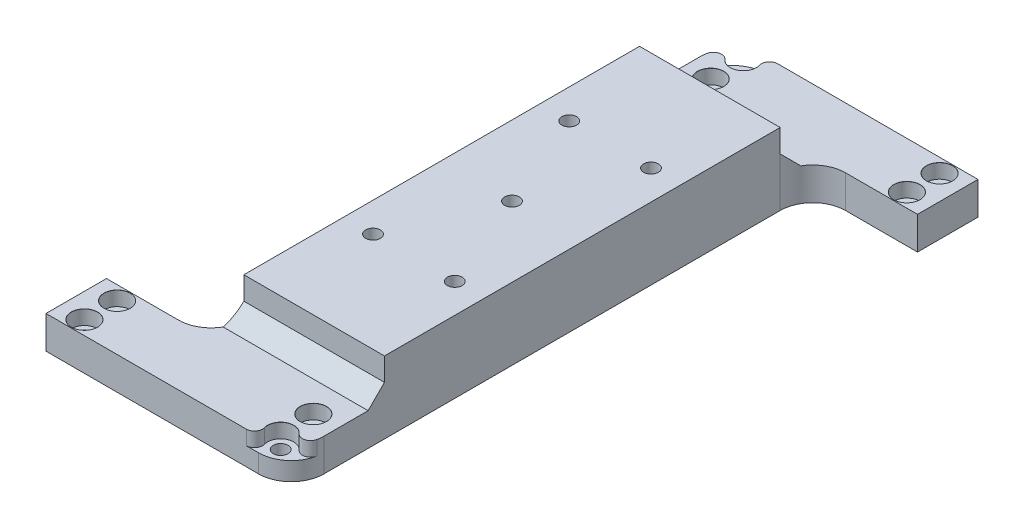
from build123d import *

# Parameters (mm, degrees)
BOSS_EXTRUDE1_DEPTH                          = 10
FILLET1_R                                    = 10
SKETCH2_R                                    = 1.75
CUT_EXTRUDE1_DEPTH                           = 10
CBORE_FOR_M4_HEX_SOCKET_HEAD_CAP_SCR_2_COUNT = 2
CBORE_FOR_M4_HEX_SOCKET_HEAD_CAP_SCR_2_PITCH = 10
CBORE_FOR_M4_HEX_SOCKET_HEAD_CAP_SCR_3_COUNT = 2
CBORE_FOR_M4_HEX_SOCKET_HEAD_CAP_SCR_3_PITCH = 60
CBORE_FOR_M4_HEX_SOCKET_HEAD_CAP_SCR_4_COUNT = 2
CBORE_FOR_M4_HEX_SOCKET_HEAD_CAP_SCR_4_PITCH = 152.099474029
CBORE_FOR_M4_HEX_SOCKET_HEAD_CAP_SCR_5_COUNT = 2
CBORE_FOR_M4_HEX_SOCKET_HEAD_CAP_SCR_5_PITCH = 161.939031737
CBORE_FOR_M4_HEX_SOCKET_HEAD_CAP_SCR_6_COUNT = 2
CBORE_FOR_M4_HEX_SOCKET_HEAD_CAP_SCR_6_PITCH = 162.67836365
CBORE_FOR_M4_HEX_SOCKET_HEAD_CAP_SCR_7_COUNT = 2
CBORE_FOR_M4_HEX_SOCKET_HEAD_CAP_SCR_7_PITCH = 152.886395732
CBORE_FOR_M4_HEX_SOCKET_HEAD_CAP_SCR_8_COUNT = 2
CBORE_FOR_M4_HEX_SOCKET_HEAD_CAP_SCR_8_PITCH = 60.827625303
FILLET2_R                                    = 2.5
FILLET3_R                                    = 2.5
SKETCH5_W                                    = 43
SKETCH5_H                                    = 121
BOSS_EXTRUDE2_DEPTH                          = 12
CHAMFER1_SIZE                                = 5
SKETCH7_R                                    = 2.25
CUT_EXTRUDE2_DEPTH                           = 10
SKETCH8_R                                    = 2.25
CUT_EXTRUDE3_DEPTH                           = 10


with BuildPart() as part:
    # Sketch1 → Boss-Extrude1 (new body)
    with BuildSketch(Plane(origin=(0, 0, 0), x_dir=(1, 0, 0), z_dir=(0, 1, 0))):
        Polygon((-21.5, -89), (21.5, -89), (21.5, 70.5), (53.5, 70.5), (53.5, 89), (-21.5, 89), (-21.5, -70.5), (-53.5, -70.5), (-53.5, -89), align=None)
    extrude(amount=BOSS_EXTRUDE1_DEPTH)

    # Fillet1
    fillet1_edges = [part.edges().sort_by_distance(p)[0] for p in [
        (-21.5, 5, 70.5),
        (-21.5, 5, -89),
        (21.5, 5, -70.5),
        (21.5, 5, 89),
    ]]
    fillet(fillet1_edges, radius=FILLET1_R)

    # Sketch2 → Cut-Extrude1 (cut)
    with BuildSketch(Plane(origin=(0, 10, 0), x_dir=(1, 0, 0), z_dir=(0, 1, 0))):
        with Locations(Location((-14, 74.75, 0), (0, 0, 270))):
            Circle(SKETCH2_R)
        with Locations(Location((-14, 84.75, 0), (0, 0, 270))):
            Circle(SKETCH2_R)
        with Locations(Location((46, 74.75, 0), (0, 0, 270))):
            Circle(SKETCH2_R)
        with Locations(Location((46, 84.75, 0), (0, 0, 270))):
            Circle(SKETCH2_R)
        with Locations(Location((-46, -74.75, 0), (0, 0, 270))):
            Circle(SKETCH2_R)
        with Locations(Location((-46, -84.75, 0), (0, 0, 270))):
            Circle(SKETCH2_R)
        with Locations(Location((14, -74.75, 0), (0, 0, 270))):
            Circle(SKETCH2_R)
        with Locations(Location((14, -84.75, 0), (0, 0, 270))):
            Circle(SKETCH2_R)
    extrude(amount=-CUT_EXTRUDE1_DEPTH, mode=Mode.SUBTRACT)

    # Sketch4 → CBORE for M4 Hex Socket Head Cap Screw1 (revolve, cut)
    with BuildSketch(Plane(origin=(-14, 10, -74.75), x_dir=(0, 0, 1), z_dir=(1, 0, 0))):
        Polygon((0, 0), (0, 11.351936393), (2.25, 10), (2.25, 4.4), (4, 4.4), (4, 0.025), (4.025, 0), align=None)
    cbore_for_m4_hex_socket_head_cap_screw1 = revolve(axis=Axis((-14, 16.35, -74.75), (0, -1, 0)), mode=Mode.SUBTRACT)

    # CBORE for M4 Hex Socket Head Cap Scr 2: CBORE for M4 Hex Socket Head Cap Screw1 ×2
    with Locations(*[(0, 0, -i * CBORE_FOR_M4_HEX_SOCKET_HEAD_CAP_SCR_2_PITCH) for i in range(1, CBORE_FOR_M4_HEX_SOCKET_HEAD_CAP_SCR_2_COUNT)]):
        add(cbore_for_m4_hex_socket_head_cap_screw1, mode=Mode.SUBTRACT)

    # CBORE for M4 Hex Socket Head Cap Scr 3: CBORE for M4 Hex Socket Head Cap Screw1 ×2
    with Locations(*[(i * CBORE_FOR_M4_HEX_SOCKET_HEAD_CAP_SCR_3_PITCH, 0, 0) for i in range(1, CBORE_FOR_M4_HEX_SOCKET_HEAD_CAP_SCR_3_COUNT)]):
        add(cbore_for_m4_hex_socket_head_cap_screw1, mode=Mode.SUBTRACT)

    # CBORE for M4 Hex Socket Head Cap Scr 4: CBORE for M4 Hex Socket Head Cap Screw1 ×2
    with Locations(*[Vector(0.1840900514527529, 0, 0.9829093818639248) * (i * CBORE_FOR_M4_HEX_SOCKET_HEAD_CAP_SCR_4_PITCH) for i in range(1, CBORE_FOR_M4_HEX_SOCKET_HEAD_CAP_SCR_4_COUNT)]):
        add(cbore_for_m4_hex_socket_head_cap_screw1, mode=Mode.SUBTRACT)

    # CBORE for M4 Hex Socket Head Cap Scr 5: CBORE for M4 Hex Socket Head Cap Screw1 ×2
    with Locations(*[Vector(0.1729045783441913, 0, 0.9849385802107751) * (i * CBORE_FOR_M4_HEX_SOCKET_HEAD_CAP_SCR_5_PITCH) for i in range(1, CBORE_FOR_M4_HEX_SOCKET_HEAD_CAP_SCR_5_COUNT)]):
        add(cbore_for_m4_hex_socket_head_cap_screw1, mode=Mode.SUBTRACT)

    # CBORE for M4 Hex Socket Head Cap Scr 6: CBORE for M4 Hex Socket Head Cap Screw1 ×2
    with Locations(*[Vector(-0.19670716671795496, 0, 0.9804622841097942) * (i * CBORE_FOR_M4_HEX_SOCKET_HEAD_CAP_SCR_6_PITCH) for i in range(1, CBORE_FOR_M4_HEX_SOCKET_HEAD_CAP_SCR_6_COUNT)]):
        add(cbore_for_m4_hex_socket_head_cap_screw1, mode=Mode.SUBTRACT)

    # CBORE for M4 Hex Socket Head Cap Scr 7: CBORE for M4 Hex Socket Head Cap Screw1 ×2
    with Locations(*[Vector(-0.20930573872668637, 0, 0.9778502481137263) * (i * CBORE_FOR_M4_HEX_SOCKET_HEAD_CAP_SCR_7_PITCH) for i in range(1, CBORE_FOR_M4_HEX_SOCKET_HEAD_CAP_SCR_7_COUNT)]):
        add(cbore_for_m4_hex_socket_head_cap_screw1, mode=Mode.SUBTRACT)

    # CBORE for M4 Hex Socket Head Cap Scr 8: CBORE for M4 Hex Socket Head Cap Screw1 ×2
    with Locations(*[Vector(0.9863939238321426, 0, -0.1643989873053641) * (i * CBORE_FOR_M4_HEX_SOCKET_HEAD_CAP_SCR_8_PITCH) for i in range(1, CBORE_FOR_M4_HEX_SOCKET_HEAD_CAP_SCR_8_COUNT)]):
        add(cbore_for_m4_hex_socket_head_cap_screw1, mode=Mode.SUBTRACT)

    # Fillet2
    # the kernel refuses this fillet: 2.5 mm, written as the material it takes off along each edge
    with BuildSketch(Plane(origin=(-13.754801439, 5.6, -88.742477635), x_dir=(0.9990847033117879, 0, -0.042775642699985884), z_dir=(0, 1, 0))) as fillet2_piece_1:
        with BuildLine():
            CenterArc((5.91336471, -2.497711758), FILLET2_R, 87.548388178, 105.618498276)
            Line((3.479087926, -3.067182162), (3.235660248, -3.124129202))
            ThreePointArc((3.235660248, -3.124129202), (2.064143441, -1.165399671), (-0.025984683, -0.248645925))
            Line((-0.025984683, -0.248645925), (-0.045899922, 0.245750274))
            ThreePointArc((-0.045899922, 0.245750274), (2.274447223, 0.410607251), (6.030997727, 0.249771176))
            Line((6.030997727, 0.249771176), (6.020303816, 0))
        make_face()
    extrude(amount=19.425759541, mode=Mode.SUBTRACT)
    with BuildSketch(Plane(origin=(-17.087010961, 5.6, -87.293690886), x_dir=(-0.5524220177087732, 0, 0.8335645831911094), z_dir=(0, 1, 0))) as fillet2_piece_2:
        with BuildLine():
            CenterArc((6.697143458, 2.309687979), FILLET2_R, 165.124054411, 127.376595494)
            ThreePointArc((4.280933593, 2.951505625), (2.685480046, 0.685252699), (0, 0))
            ThreePointArc((0, 0), (3.826939119, -0.761248083), (7.653878238, 0))
        make_face()
    extrude(amount=23.509695594, mode=Mode.SUBTRACT)

    # Fillet3
    # the kernel refuses this fillet: 2.5 mm, written as the material it takes off along each edge
    with BuildSketch(Plane(origin=(13.75480144, 5.6, 88.742477635), x_dir=(-0.7777172566996915, 0, -0.6286142446934416), z_dir=(0, 1, 0))) as fillet3_piece_1:
        with BuildLine():
            CenterArc((6.087462048, 2.036971289), FILLET3_R, 128.947957862, 105.618498276)
            Line((4.515926436, 3.98126443), (4.358772875, 4.175693744))
            ThreePointArc((4.358772875, 4.175693744), (1.434562202, 1.812109205), (-0.196946455, 0.153987317))
            Line((-0.196946455, 0.153987317), (0.144939573, -0.203697129))
            ThreePointArc((0.144939573, -0.203697129), (2.319033161, 0.490845938), (4.49312675, -0.203697129))
            Line((4.49312675, -0.203697129), (4.638066322, 0))
        make_face()
    extrude(amount=19.425759541, mode=Mode.SUBTRACT)
    with BuildSketch(Plane(origin=(17.087010961, 5.6, 87.293690886), x_dir=(-0.018344711955799436, 0, -0.9998317216128216), z_dir=(0, 1, 0))) as fillet3_piece_2:
        with BuildLine():
            CenterArc((6.824719559, -1.89989263), FILLET3_R, 130.539588182, 127.376595494)
            ThreePointArc((6.30136363, -4.344498645), (2.718581752, -2.798977477), (0, 0))
            ThreePointArc((0, 0), (2.599893165, -0.960171793), (5.19978633, 0))
        make_face()
    extrude(amount=23.509695594, mode=Mode.SUBTRACT)

    # Sketch5 → Boss-Extrude2 (add)
    with BuildSketch(Plane(origin=(0, 10, 0), x_dir=(1, 0, 0), z_dir=(0, 1, 0))):
        Rectangle(SKETCH5_W, SKETCH5_H)
    extrude(amount=BOSS_EXTRUDE2_DEPTH)

    # Chamfer1
    # the kernel refuses this chamfer: 5 mm, written as the material it adds along each edge
    with BuildSketch(Plane(origin=(34.35841494, 10, -60.5), x_dir=(0, -0.027495876610586317, -0.9996219169112968), z_dir=(-1, 0, 0))) as chamfer1_piece_1_section:
        Polygon((CHAMFER1_SIZE * 0.999621916911, -CHAMFER1_SIZE * 0.0274958766106), (-CHAMFER1_SIZE * 0.0274958766106, -CHAMFER1_SIZE * 0.999621916911), (0, 0), align=None)
    chamfer1_piece_1 = extrude(amount=55.85841494, mode=Mode.PRIVATE)
    chamfer1_piece_1 = chamfer1_piece_1 - Plane(origin=(31.5, 10.859011568, -60.5), x_dir=(0, 0, -1), z_dir=(0, 1, 0)) * Cylinder(10, 132, mode=Mode.PRIVATE)
    add(chamfer1_piece_1)
    with BuildSketch(Plane(origin=(-34.35841494, 10, 60.5), x_dir=(0, -0.027495876610586317, 0.9996219169112968), z_dir=(1, 0, 0))) as chamfer1_piece_2_section:
        Polygon((CHAMFER1_SIZE * 0.999621916911, -CHAMFER1_SIZE * 0.0274958766106), (-CHAMFER1_SIZE * 0.0274958766106, -CHAMFER1_SIZE * 0.999621916911), (0, 0), align=None)
    chamfer1_piece_2 = extrude(amount=55.85841494, mode=Mode.PRIVATE)
    chamfer1_piece_2 = chamfer1_piece_2 - Plane(origin=(-31.5, 10.859011568, 60.5), x_dir=(0, 0, 1), z_dir=(0, 1, 0)) * Cylinder(10, 132, mode=Mode.PRIVATE)
    add(chamfer1_piece_2)

    # Sketch7 → Cut-Extrude2 (cut)
    with BuildSketch(Plane(origin=(0, 22, 0), x_dir=(1, 0, 0), z_dir=(0, 1, 0))):
        with Locations(Location((0, 0, 0), (0, 0, 270))):
            Circle(SKETCH7_R)
    extrude(amount=-CUT_EXTRUDE2_DEPTH, mode=Mode.SUBTRACT)

    # Sketch8 → Cut-Extrude3 (cut)
    with BuildSketch(Plane(origin=(0, 22, 0), x_dir=(1, 0, 0), z_dir=(0, 1, 0))):
        with Locations(Location((12.5, 30, 0), (0, 0, 270))):
            Circle(SKETCH8_R)
        with Locations(Location((-12.5, 30, 0), (0, 0, 270))):
            Circle(SKETCH8_R)
        with Locations(Location((-12.5, -30, 0), (0, 0, 270))):
            Circle(SKETCH8_R)
        with Locations(Location((12.5, -30, 0), (0, 0, 270))):
            Circle(SKETCH8_R)
    extrude(amount=-CUT_EXTRUDE3_DEPTH, mode=Mode.SUBTRACT)


solid = part.part
